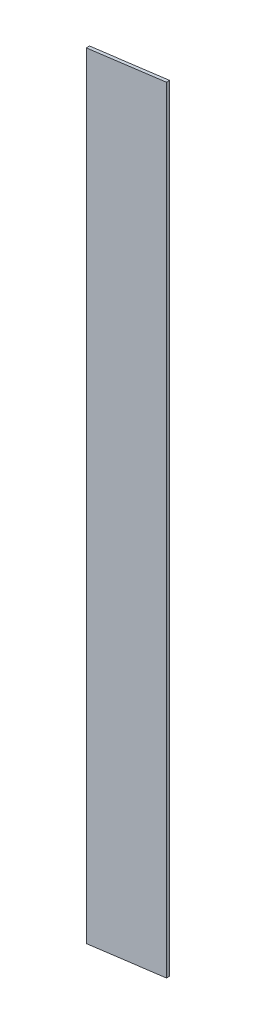
from build123d import *

# Parameters (mm, degrees)
SKETCH_1_W          = 50
SKETCH_1_H          = 650
EXTRUDE_1_DEPTH     = 1
CUT_EXTRUDE_START   = -2
CUT_EXTRUDE_1_DEPTH = 2


# Read off the part's stored shape, not the designer's step: Вырез-Вытянуть1
with BuildPart() as part:
    # Эскиз1 → Бобышка-Вытянуть1 (new, symmetric)
    with BuildSketch(Plane.XY):
        Rectangle(SKETCH_1_W, SKETCH_1_H)
    extrude(amount=EXTRUDE_1_DEPTH, both=True)

    # Вырез-Вытянуть1 outline → Вырез-Вытянуть1 (cut)
    with BuildSketch(Plane(origin=(0, 0, -1), x_dir=(-1, 0, 0), z_dir=(0, 0, -1)).offset(CUT_EXTRUDE_START)):
        Polygon((-25, 248.394189154), (25, 241.971775361), (25, 325), (-25, 325), align=None)
        Polygon((25, -325), (25, -241.971775361), (-25, -235.549361568), (-25, -325), align=None)
    extrude(amount=CUT_EXTRUDE_1_DEPTH, mode=Mode.SUBTRACT)


solid = part.part
